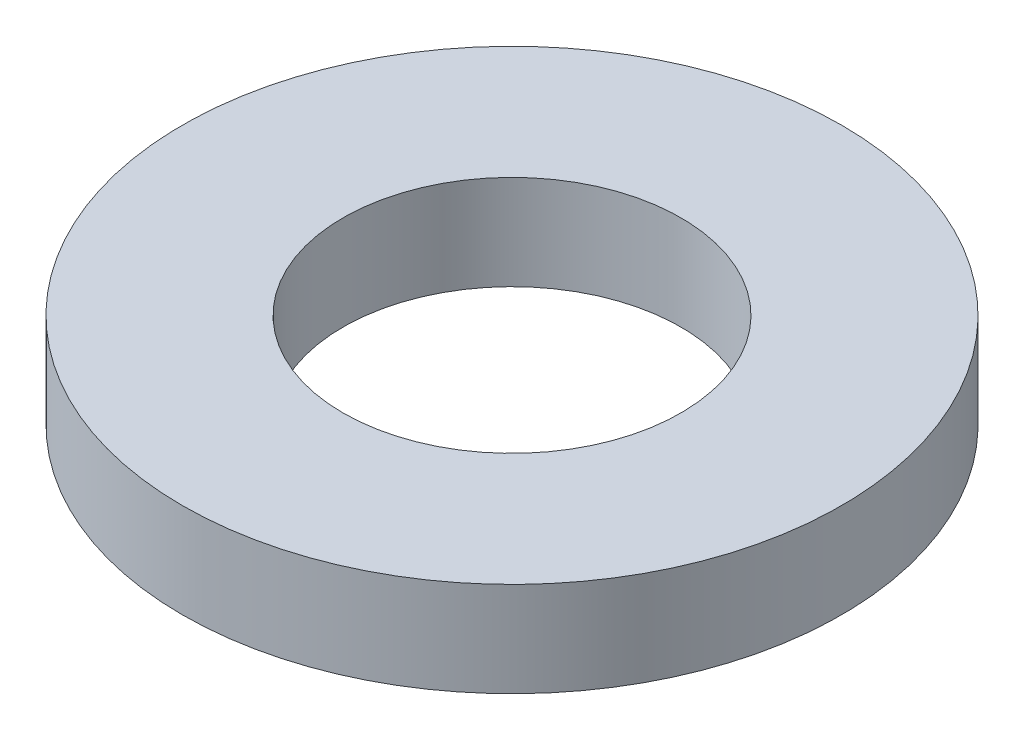
from build123d import *

# Parameters (mm, degrees)
SKETCH1_R           = 97.5
BOSS_EXTRUDE1_DEPTH = 28
SKETCH2_R           = 50
CUT_EXTRUDE1_DEPTH  = 141.700035537


with BuildPart() as part:
    # Sketch1 → Boss-Extrude1 (new body)
    with BuildSketch(Plane(origin=(0, 0, 0), x_dir=(1, 0, 0), z_dir=(0, 1, 0))):
        Circle(SKETCH1_R)
    extrude(amount=BOSS_EXTRUDE1_DEPTH)

    # Sketch2 → Cut-Extrude1 (cut, through all)
    with BuildSketch(Plane(origin=(0, 0, 0), x_dir=(1, 0, 0), z_dir=(0, 1, 0))):
        Circle(SKETCH2_R)
    extrude(amount=CUT_EXTRUDE1_DEPTH, mode=Mode.SUBTRACT)


solid = part.part
